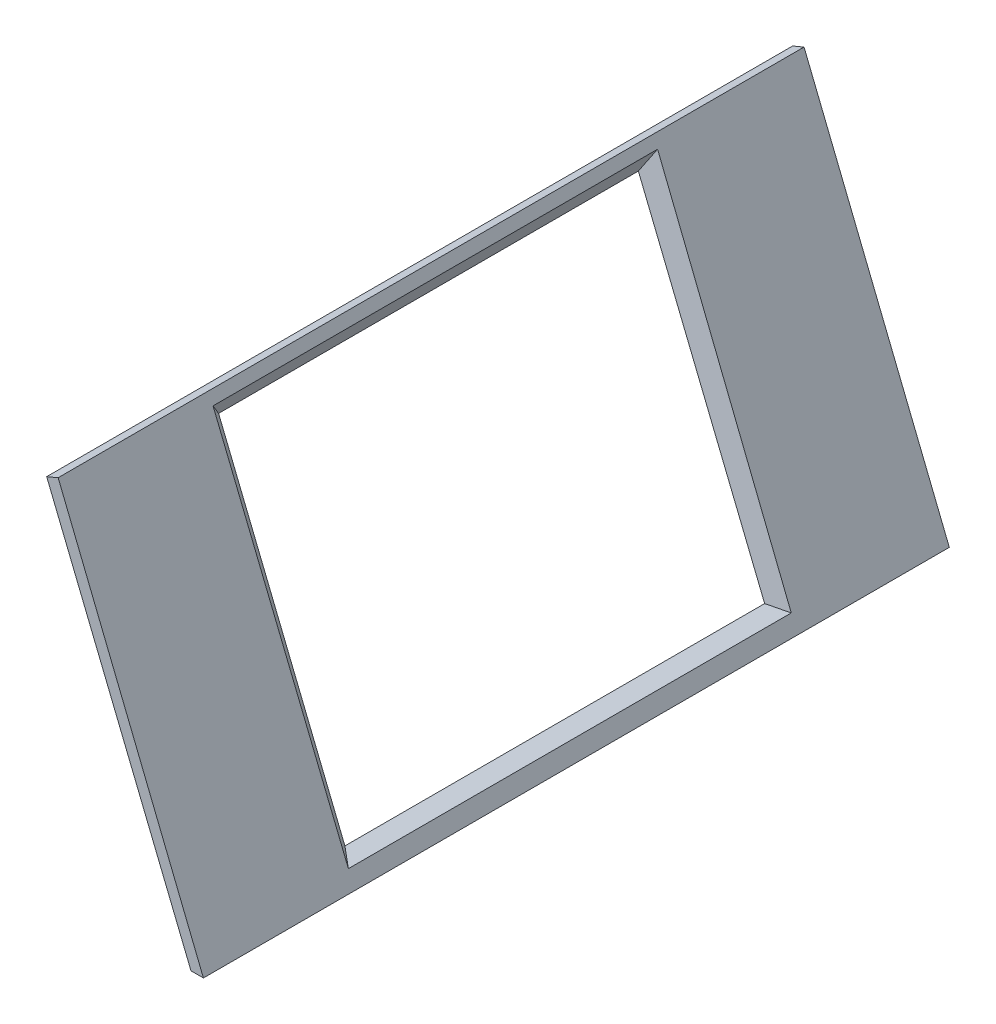
from build123d import *

# Parameters (mm, degrees)
BOSS_EXTRU_1_DEPTH      = 600
ESQUISSE2_W             = 337.64601
ESQUISSE2_H             = 270.2999928
ENL_V_MAT_EXTRU_1_DEPTH = 10
ENL_V_MAT_EXTRU_1_DRAFT = 45


with BuildPart() as part:
    # Esquisse1 → Boss.-Extru.1 (new body)
    with BuildSketch(Plane.XY):
        Polygon((219.734545737, 127.183031526), (103.65574387, 413.400422848), (112.874448857, 417.275403928), (229.734545737, 127.183031526), align=None)
    extrude(amount=BOSS_EXTRU_1_DEPTH)


with BuildPart() as enl_v_mat_extru_1_tool:
    # Esquisse2 → Enlèv. mat.-Extru.1 (with draft: the straight prism first)
    with BuildSketch(Plane(origin=(232.992448308, 94.492805342, 0), x_dir=(0, 0, 1), z_dir=(-0.926688841813853, -0.3758294699164765, 0))):
        with Locations((300.126729953, 189.71190213)):
            Rectangle(ESQUISSE2_W, ESQUISSE2_H)
    extrude(amount=-ENL_V_MAT_EXTRU_1_DEPTH)
    # Enlèv. mat.-Extru.1: the draft: its side faces are tilted about the plane it starts from
    enl_v_mat_extru_1_sides = [enl_v_mat_extru_1_tool.faces().sort_by_distance(p)[0] for p in [
        (166.326568903, 272.175855554, 131.303724953),
        (217.119920409, 146.933861919, 300.126729953),
        (166.326568903, 272.175855554, 468.949734953),
        (115.533217396, 397.41784919, 300.126729953),
    ]]
    draft(enl_v_mat_extru_1_sides, Plane(origin=(232.992448308, 94.492805342, 0), x_dir=(0, 0, 1), z_dir=(-0.926688841813853, -0.3758294699164765, 0)), ENL_V_MAT_EXTRU_1_DRAFT)


with BuildPart() as part_1:
    add(part.part)

    # Enlèv. mat.-Extru.1: cut by enl_v_mat_extru_1_tool
    add(enl_v_mat_extru_1_tool.part, mode=Mode.SUBTRACT)


solid = part_1.part
